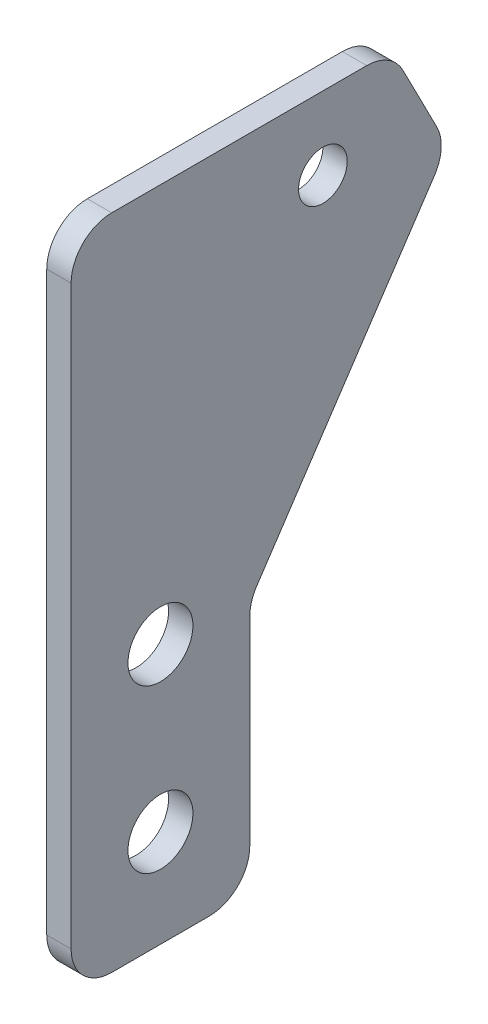
from build123d import *

# Parameters (mm, degrees)
SZKIC1_R                    = 4
SZKIC1_R_2                  = 3
DODANIE_WYCI_GNI_CIE1_DEPTH = 3


with BuildPart() as part:
    # Szkic1 → Dodanie-wyciągnięcie1 (new body)
    with BuildSketch(Plane(origin=(0, 0, 0), x_dir=(0, 0, -1), z_dir=(1, 0, 0))):
        with BuildLine():
            Line((316.470861515, -192.717240122), (347.869310148, -192.717240122))
            ThreePointArc((347.869310148, -192.717240122), (350.474310451, -193.449456924), (352.316340757, -195.431650752))
            Line((352.316340757, -195.431650752), (356.492131769, -203.556413095))
            ThreePointArc((356.492131769, -203.556413095), (357.037087238, -206.124977735), (356.205352632, -208.615503446))
            Line((356.205352632, -208.615503446), (334.310610043, -241.457617329))
            ThreePointArc((334.310610043, -241.457617329), (333.685401382, -242.782197567), (333.470861515, -244.231118311))
            Line((333.470861515, -244.231118311), (333.470861515, -268.717240122))
            ThreePointArc((333.470861515, -268.717240122), (332.006395421, -272.252774028), (328.470861515, -273.717240122))
            Line((328.470861515, -273.717240122), (316.470861515, -273.717240122))
            ThreePointArc((316.470861515, -273.717240122), (312.935327609, -272.252774028), (311.470861515, -268.717240122))
            Line((311.470861515, -268.717240122), (311.470861515, -197.717240122))
            ThreePointArc((311.470861515, -197.717240122), (312.935327609, -194.181706216), (316.470861515, -192.717240122))
        make_face()
        with Locations((322.470861515, -241.717240122)):
            Circle(SZKIC1_R, mode=Mode.SUBTRACT)
        with Locations((322.470861515, -261.717240122)):
            Circle(SZKIC1_R, mode=Mode.SUBTRACT)
        with Locations((342.470861515, -201.717240122)):
            Circle(SZKIC1_R_2, mode=Mode.SUBTRACT)
    extrude(amount=DODANIE_WYCI_GNI_CIE1_DEPTH)


solid = part.part
